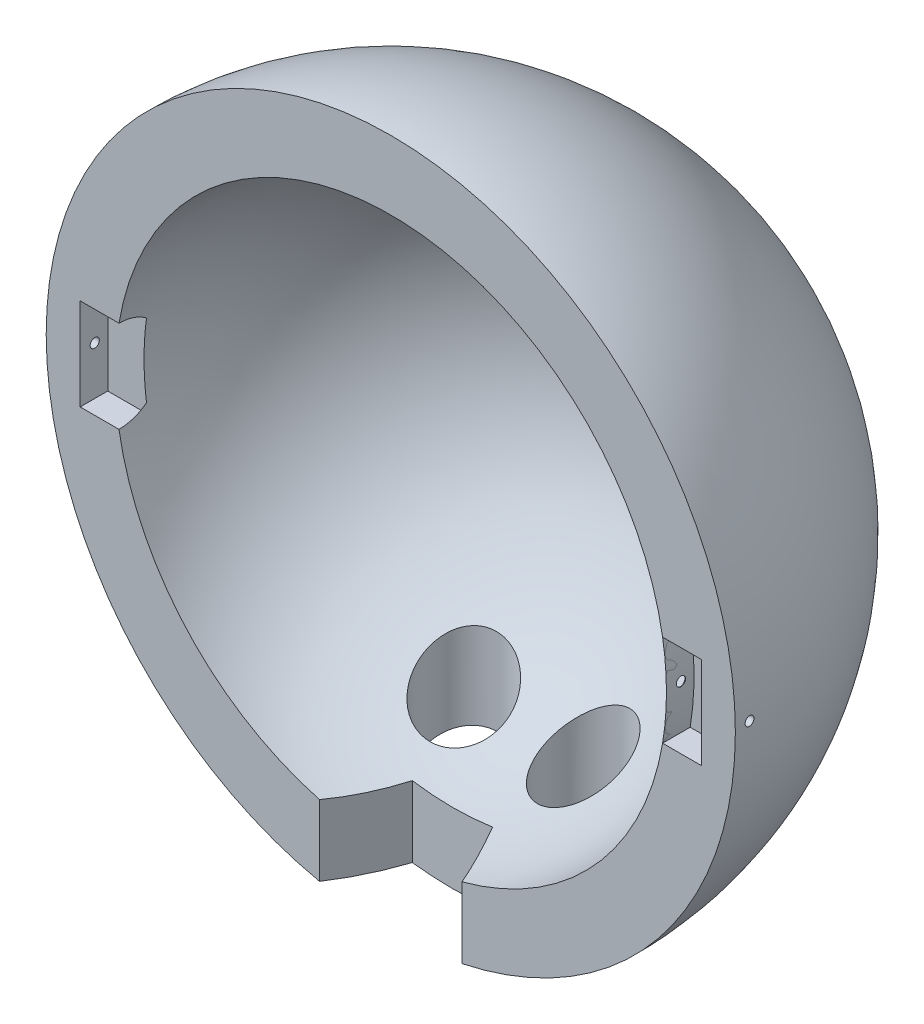
from build123d import *

# Parameters (mm, degrees)
REVOLU_O1_ANGLE             = 180
ESBO_O5_R                   = 8.75
CORTE_EXTRUS_O2_DEPTH       = 130.903810568
CORTE_EXTRUS_O3_DEPTH       = 130.903810568
CORTE_EXTRUS_O5_DEPTH       = 130.903810568
CORTE_EXTRUS_O5_DEPTH_BACK  = 130.903810568
ESBO_O10_W                  = 35
ESBO_O10_H                  = 10
ESBO_O7_R                   = 10.976921181
CORTE_EXTRUS_O6_DEPTH       = 129.719656675
CORTE_EXTRUS_O13_DEPTH      = 10
CORTE_EXTRUS_O13_DEPTH_BACK = 100
ESBO_O12_R                  = 0.7
CORTE_EXTRUS_O14_DEPTH      = 100
CORTE_EXTRUS_O14_DEPTH_BACK = 100
ESBO_O13_R                  = 2
ESBO_O13_R_2                = 1.25
ESBO_O3_W                   = 8.439202169
ESBO_O3_H                   = 20
CUT_EXTRUDE5_DEPTH          = 6
CUT_EXTRUDE6_DEPTH          = 166
CUT_EXTRUDE6_DEPTH_BACK     = 25
SKETCH5_R                   = 1


with BuildPart() as part:
    # Esboço1 → Revolução1 (revolve)
    with BuildSketch(Plane.XY):
        with BuildLine():
            Line((-60, 0), (-75, 0))
            ThreePointArc((-75, 0), (0, 75), (75, 0))
            Line((75, 0), (60, 0))
            ThreePointArc((60, 0), (0, 60), (-60, 0))
        make_face()
    revolve(axis=Axis((-60, 0, 0), (-1, 0, 0)), revolution_arc=REVOLU_O1_ANGLE)

    # Esboço5 → Corte-extrusão2 (cut, through all)
    with BuildSketch(Plane(origin=(0, 0, 0), x_dir=(1, 0, 0), z_dir=(0, 1, 0))):
        with Locations((-13, 28.889517761)):
            Circle(ESBO_O5_R)
        with Locations((13, 28.889517761)):
            Circle(ESBO_O5_R)
    extrude(amount=-CORTE_EXTRUS_O2_DEPTH, mode=Mode.SUBTRACT)

    # Esboço6 → Corte-extrusão3 (cut, through all)
    with BuildSketch(Plane(origin=(0, 0, 0), x_dir=(1, 0, 0), z_dir=(0, 1, 0))):
        Polygon((0, 0), (15.5, 0), (8.67886803, 13.5), (-8.82113197, 13.5), (-15.5, 0), align=None)
    extrude(amount=-CORTE_EXTRUS_O3_DEPTH, mode=Mode.SUBTRACT)

    # Esboço10 → Corte-extrusão5 (cut, two sides: drawn at the far end of the back side and taken through both)
    with BuildSketch(Plane(origin=(0, 0, 0), x_dir=(1, 0, 0), z_dir=(0, 1, 0)).offset(-CORTE_EXTRUS_O5_DEPTH_BACK)):
        with Locations((0, 77.929760729)):
            Rectangle(ESBO_O10_W, ESBO_O10_H)
    extrude(amount=CORTE_EXTRUS_O5_DEPTH + CORTE_EXTRUS_O5_DEPTH_BACK, mode=Mode.SUBTRACT)

    # Esboço7 → Corte-extrusão6 (cut, through all)
    with BuildSketch(Plane.XY):
        with Locations((0, 30)):
            Circle(ESBO_O7_R)
    extrude(amount=-CORTE_EXTRUS_O6_DEPTH, mode=Mode.SUBTRACT)

    # Esboço12 → Corte-extrusão13 (cut, two sides: drawn at the far end of the back side and taken through both)
    with BuildSketch(Plane.XY.offset(-CORTE_EXTRUS_O13_DEPTH_BACK)):
        with Locations((13.25, 0)):
            Circle(ESBO_O12_R)
        with Locations((-13.25, 0)):
            Circle(ESBO_O12_R)
    extrude(amount=CORTE_EXTRUS_O13_DEPTH + CORTE_EXTRUS_O13_DEPTH_BACK, mode=Mode.SUBTRACT)

    # Esboço13 → Corte-extrusão14 (cut, two sides: drawn at the far end of the back side and taken through both)
    with BuildSketch(Plane(origin=(0, 0, -72.929760729), x_dir=(-1, 0, 0), z_dir=(0, 0, -1)).offset(-CORTE_EXTRUS_O14_DEPTH_BACK)):
        Circle(ESBO_O13_R)
        with Locations((-8, 0)):
            Circle(ESBO_O13_R_2)
        with Locations((8, 0)):
            Circle(ESBO_O13_R_2)
    extrude(amount=CORTE_EXTRUS_O14_DEPTH + CORTE_EXTRUS_O14_DEPTH_BACK, mode=Mode.SUBTRACT)

    # Esboço3 → Cut-Extrude5 (cut)
    with BuildSketch(Plane.XY):
        with Locations((-63.380398916, 0)):
            Rectangle(ESBO_O3_W, ESBO_O3_H)
        with BuildLine():
            Line((59.160797831, -10), (67.6, -10))
            Line((67.6, -10), (67.6, 10))
            Line((67.6, 10), (59.160797831, 10))
            ThreePointArc((59.160797831, 10), (60, 0), (59.160797831, -10))
        make_face()
    extrude(amount=-CUT_EXTRUDE5_DEPTH, mode=Mode.SUBTRACT)

    # Sketch5 → Cut-Extrude6 (cut, two sides: drawn at the far end of the back side and taken through both)
    with BuildSketch(Plane(origin=(-67.6, 0, 0), x_dir=(0, 0, -1), z_dir=(1, 0, 0)).offset(-CUT_EXTRUDE6_DEPTH_BACK)):
        with Locations((3.16060341, 0.488172994)):
            Circle(SKETCH5_R)
    extrude(amount=CUT_EXTRUDE6_DEPTH + CUT_EXTRUDE6_DEPTH_BACK, mode=Mode.SUBTRACT)


solid = part.part
